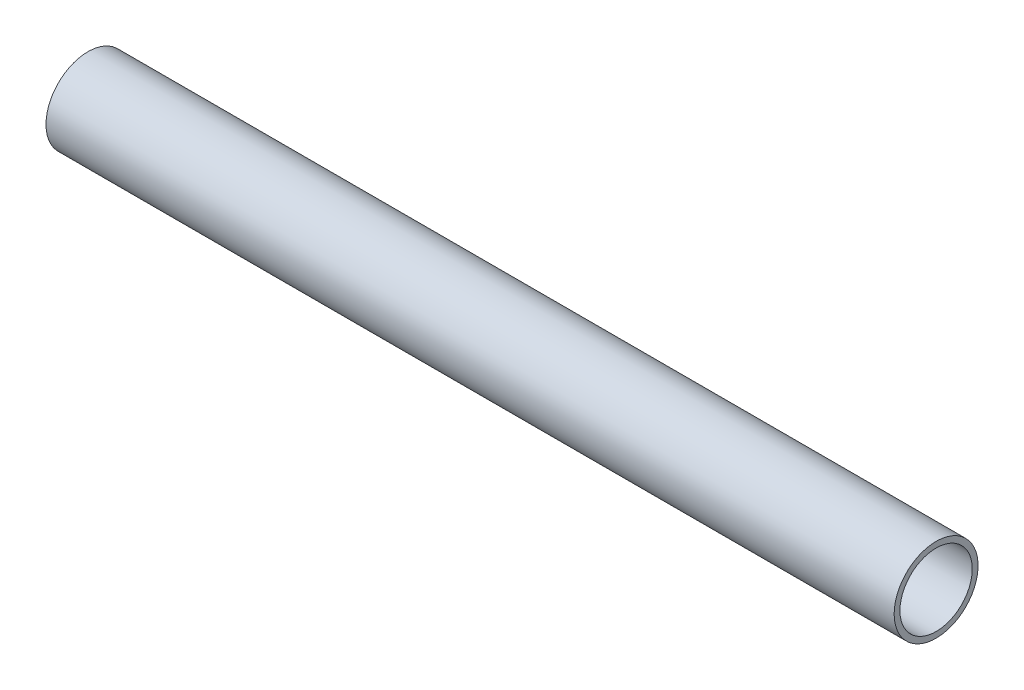
from build123d import *

# Parameters (mm, degrees)
SKETCH1_R           = 30.1625
SKETCH1_R_2         = 25.9969
BOSS_EXTRUDE1_DEPTH = 609.6


with BuildPart() as part:
    # Sketch1 → Boss-Extrude1 (new body)
    with BuildSketch(Plane(origin=(0, 0, 0), x_dir=(0, 0, -1), z_dir=(1, 0, 0))):
        Circle(SKETCH1_R)
        Circle(SKETCH1_R_2, mode=Mode.SUBTRACT)
    extrude(amount=BOSS_EXTRUDE1_DEPTH)


solid = part.part
